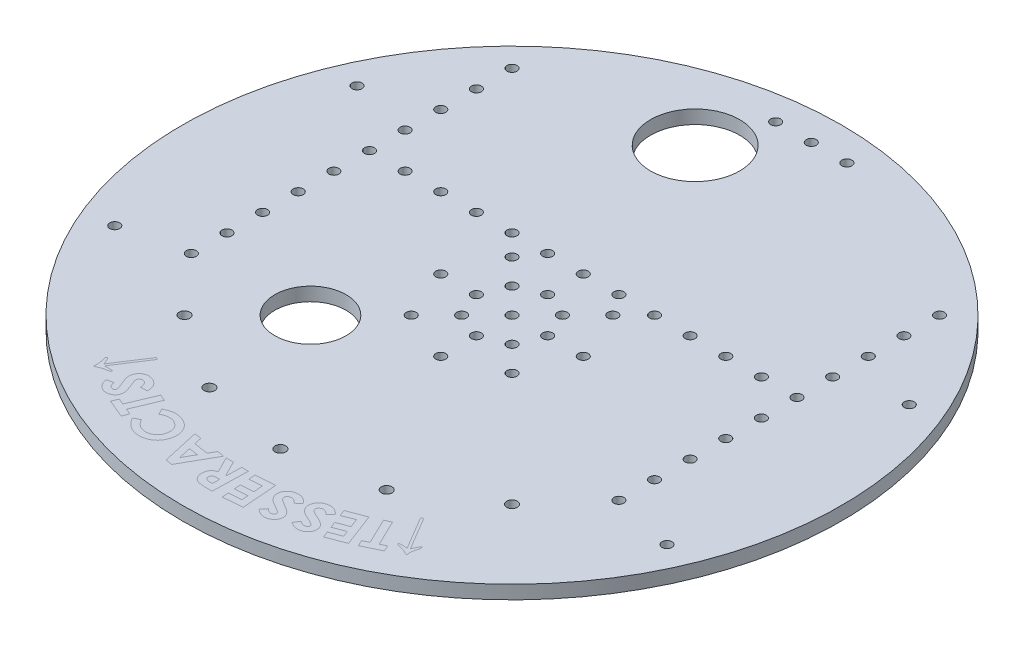
from build123d import *

# Parameters (mm, degrees)
SKETCH1_R           = 117.475
BOSS_EXTRUDE1_DEPTH = 4.826
SKETCH4_R           = 1.778
CUT_EXTRUDE5_DEPTH  = 167.204817999
SKETCH5_R           = 1.778
CUT_EXTRUDE6_DEPTH  = 167.204817999
SKETCH6_R           = 1.778
CUT_EXTRUDE7_DEPTH  = 167.204817999
SKETCH9_R           = 1.905
CUT_EXTRUDE10_DEPTH = 167.204817999
CIRPATTERN1_COUNT   = 3
CIRPATTERN1_ANGLE   = 45
CIRPATTERN2_COUNT   = 3
CIRPATTERN2_ANGLE   = 45
SKETCH7_R           = 1.778
CUT_EXTRUDE8_DEPTH  = 167.204817999
SKETCH8_R           = 12.7
CUT_EXTRUDE9_DEPTH  = 167.204817999
SKETCH10_R          = 15.875
CUT_EXTRUDE11_DEPTH = 167.204817999
SKETCH15_R          = 1.778
CUT_EXTRUDE12_DEPTH = 167.204817999
SKETCH16_R          = 1.778
CUT_EXTRUDE13_DEPTH = 167.204817999


with BuildPart() as part:
    # Sketch1 → Boss-Extrude1 (new body)
    with BuildSketch(Plane(origin=(0, 0, 0), x_dir=(1, 0, 0), z_dir=(0, 1, 0))):
        Circle(SKETCH1_R)
    extrude(amount=-BOSS_EXTRUDE1_DEPTH)

    # Sketch4 → Cut-Extrude5 (cut, through all)
    with BuildSketch(Plane(origin=(0, 0, 0), x_dir=(1, 0, 0), z_dir=(0, 1, 0))):
        with Locations((-76.2, 0)):
            Circle(SKETCH4_R)
        with Locations((-76.2, 12.7)):
            Circle(SKETCH4_R)
        with Locations((-76.2, 25.4)):
            Circle(SKETCH4_R)
        with Locations((-76.2, 38.1)):
            Circle(SKETCH4_R)
        with Locations((-76.2, -12.7)):
            Circle(SKETCH4_R)
        with Locations((-76.2, -25.4)):
            Circle(SKETCH4_R)
        with Locations((-76.2, -38.1)):
            Circle(SKETCH4_R)
        with Locations((-76.2, 50.8)):
            Circle(SKETCH4_R)
        with Locations((-76.2, 63.5)):
            Circle(SKETCH4_R)
        with Locations((-76.2, 76.2)):
            Circle(SKETCH4_R)
    cut_extrude5 = extrude(amount=-CUT_EXTRUDE5_DEPTH, mode=Mode.SUBTRACT)

    # Mirror3: Cut-Extrude5 across plane
    add(cut_extrude5.mirror(Plane(origin=(0, 0, 0), x_dir=(0, 0, 1), z_dir=(1, 0, 0))), mode=Mode.SUBTRACT)

    # Sketch5 → Cut-Extrude6 (cut, through all)
    with BuildSketch(Plane(origin=(0, 0, 0), x_dir=(1, 0, 0), z_dir=(0, 1, 0))):
        Circle(SKETCH5_R)
    extrude(amount=-CUT_EXTRUDE6_DEPTH, mode=Mode.SUBTRACT)

    # Sketch6 → Cut-Extrude7 (cut, through all)
    with BuildSketch(Plane(origin=(0, 0, 0), x_dir=(1, 0, 0), z_dir=(0, 1, 0))):
        with Locations((0, 25.4)):
            Circle(SKETCH6_R)
        with Locations((-12.7, 25.4)):
            Circle(SKETCH6_R)
        with Locations((-25.4, 25.4)):
            Circle(SKETCH6_R)
        with Locations((-38.1, 25.4)):
            Circle(SKETCH6_R)
        with Locations((12.7, 25.4)):
            Circle(SKETCH6_R)
        with Locations((25.4, 25.4)):
            Circle(SKETCH6_R)
        with Locations((38.1, 25.4)):
            Circle(SKETCH6_R)
        with Locations((-50.8, 25.4)):
            Circle(SKETCH6_R)
        with Locations((50.8, 25.4)):
            Circle(SKETCH6_R)
        with Locations((-63.5, 25.4)):
            Circle(SKETCH6_R)
        with Locations((63.5, 25.4)):
            Circle(SKETCH6_R)
        with Locations((0, 106.68)):
            Circle(SKETCH6_R)
        with Locations((-12.7, 106.68)):
            Circle(SKETCH6_R)
        with Locations((12.7, 106.68)):
            Circle(SKETCH6_R)
    extrude(amount=-CUT_EXTRUDE7_DEPTH, mode=Mode.SUBTRACT)

    # Sketch9 → Cut-Extrude10 (cut, through all)
    with BuildSketch(Plane(origin=(0, 0, 0), x_dir=(1, 0, 0), z_dir=(0, 1, 0))):
        with Locations((0, -82.55)):
            Circle(SKETCH9_R)
    cut_extrude10 = extrude(amount=-CUT_EXTRUDE10_DEPTH, mode=Mode.SUBTRACT)

    # CirPattern1: Cut-Extrude10 ×3 about axis
    cirpattern1_axis = Axis((0, -4.826, 0), (0, 1, 0))
    for i in range(1, CIRPATTERN1_COUNT):
        add(cut_extrude10.rotate(cirpattern1_axis, i * CIRPATTERN1_ANGLE / (CIRPATTERN1_COUNT - 1)), mode=Mode.SUBTRACT)

    # CirPattern2: Cut-Extrude10 ×3 about axis
    cirpattern2_axis = Axis((0, -4.826, 0), (0, -1, 0))
    for i in range(1, CIRPATTERN2_COUNT):
        add(cut_extrude10.rotate(cirpattern2_axis, i * CIRPATTERN2_ANGLE / (CIRPATTERN2_COUNT - 1)), mode=Mode.SUBTRACT)

    # Sketch7 → Cut-Extrude8 (cut, through all)
    with BuildSketch(Plane(origin=(0, 0, 0), x_dir=(1, 0, 0), z_dir=(0, 1, 0))):
        with Locations((0, 12.7)):
            Circle(SKETCH7_R)
        with Locations((12.7, 0)):
            Circle(SKETCH7_R)
        with Locations((0, -12.7)):
            Circle(SKETCH7_R)
        with Locations((-12.7, 0)):
            Circle(SKETCH7_R)
        with Locations((-8.980256121, 8.980256121)):
            Circle(SKETCH7_R)
        with Locations((8.980256121, 8.980256121)):
            Circle(SKETCH7_R)
        with Locations((8.980256121, -8.980256121)):
            Circle(SKETCH7_R)
        with Locations((-8.980256121, -8.980256121)):
            Circle(SKETCH7_R)
    extrude(amount=-CUT_EXTRUDE8_DEPTH, mode=Mode.SUBTRACT)

    # Sketch8 → Cut-Extrude9 (cut, through all)
    with BuildSketch(Plane(origin=(0, 0, 0), x_dir=(1, 0, 0), z_dir=(0, 1, 0))):
        with Locations((-35.921024484, -35.921024484)):
            Circle(SKETCH8_R)
    extrude(amount=-CUT_EXTRUDE9_DEPTH, mode=Mode.SUBTRACT)

    # Sketch10 → Cut-Extrude11 (cut, through all)
    with BuildSketch(Plane(origin=(0, 0, 0), x_dir=(1, 0, 0), z_dir=(0, 1, 0))):
        with Locations((-19.812, 85.09)):
            Circle(SKETCH10_R)
    extrude(amount=-CUT_EXTRUDE11_DEPTH, mode=Mode.SUBTRACT)

    # Sketch15 → Cut-Extrude12 (cut, through all)
    with BuildSketch(Plane(origin=(0, 0, 0), x_dir=(1, 0, 0), z_dir=(0, 1, 0))):
        with Locations((25.4, 0)):
            Circle(SKETCH15_R)
        with Locations((17.960512242, -17.960512242)):
            Circle(SKETCH15_R)
        with Locations((0, -25.4)):
            Circle(SKETCH15_R)
        with Locations((-17.960512242, -17.960512242)):
            Circle(SKETCH15_R)
        with Locations((-25.4, 0)):
            Circle(SKETCH15_R)
        with Locations((-17.960512242, 17.960512242)):
            Circle(SKETCH15_R)
        with Locations((0, 25.4)):
            Circle(SKETCH15_R)
        with Locations((17.960512242, 17.960512242)):
            Circle(SKETCH15_R)
    extrude(amount=-CUT_EXTRUDE12_DEPTH, mode=Mode.SUBTRACT)

    # Sketch16 → Cut-Extrude13 (cut, through all)
    with BuildSketch(Plane(origin=(0, 0, 0), x_dir=(1, 0, 0), z_dir=(0, 1, 0))):
        with Locations((-98.425, 43.18)):
            Circle(SKETCH16_R)
        with Locations((-98.425, -43.18)):
            Circle(SKETCH16_R)
        with Locations((98.425, -43.18)):
            Circle(SKETCH16_R)
        with Locations((98.425, 43.18)):
            Circle(SKETCH16_R)
    extrude(amount=-CUT_EXTRUDE13_DEPTH, mode=Mode.SUBTRACT)


solid = part.part
